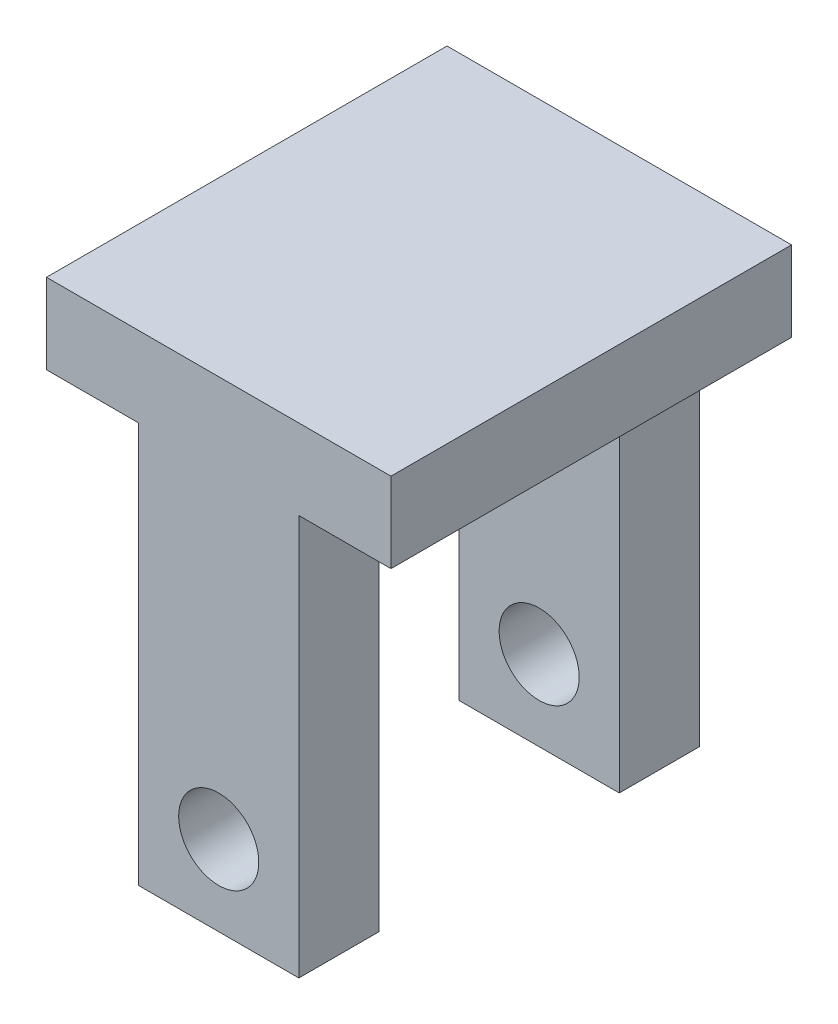
from build123d import *

# Parameters (mm, degrees)
BOSS_EXTRU_1_DEPTH      = 10
ESQUISSE2_W             = 6
ESQUISSE2_H             = 8
ENL_V_MAT_EXTRU_1_DEPTH = 17.843099477
ESQUISSE3_R             = 1
ENL_V_MAT_EXTRU_2_DEPTH = 17.201543136


with BuildPart() as part:
    # Esquisse1 → Boss.-Extru.1 (new body)
    with BuildSketch(Plane.XY):
        Polygon((2, 0), (-2, 0), (-2, 10), (-4.3, 10), (-4.3, 12), (4.3, 12), (4.3, 10), (2, 10), align=None)
    extrude(amount=BOSS_EXTRU_1_DEPTH)

    # Esquisse2 → Enlèv. mat.-Extru.1 (cut, through all)
    with BuildSketch(Plane(origin=(2, 0, 0), x_dir=(0, 0, -1), z_dir=(1, 0, 0))):
        with Locations((-5, 4)):
            Rectangle(ESQUISSE2_W, ESQUISSE2_H)
    extrude(amount=-ENL_V_MAT_EXTRU_1_DEPTH, mode=Mode.SUBTRACT)

    # Esquisse3 → Enlèv. mat.-Extru.2 (cut, through all)
    with BuildSketch(Plane(origin=(0, 0, 0), x_dir=(-1, 0, 0), z_dir=(0, 0, -1))):
        with Locations((0, 2)):
            Circle(ESQUISSE3_R)
    extrude(amount=-ENL_V_MAT_EXTRU_2_DEPTH, mode=Mode.SUBTRACT)


solid = part.part
